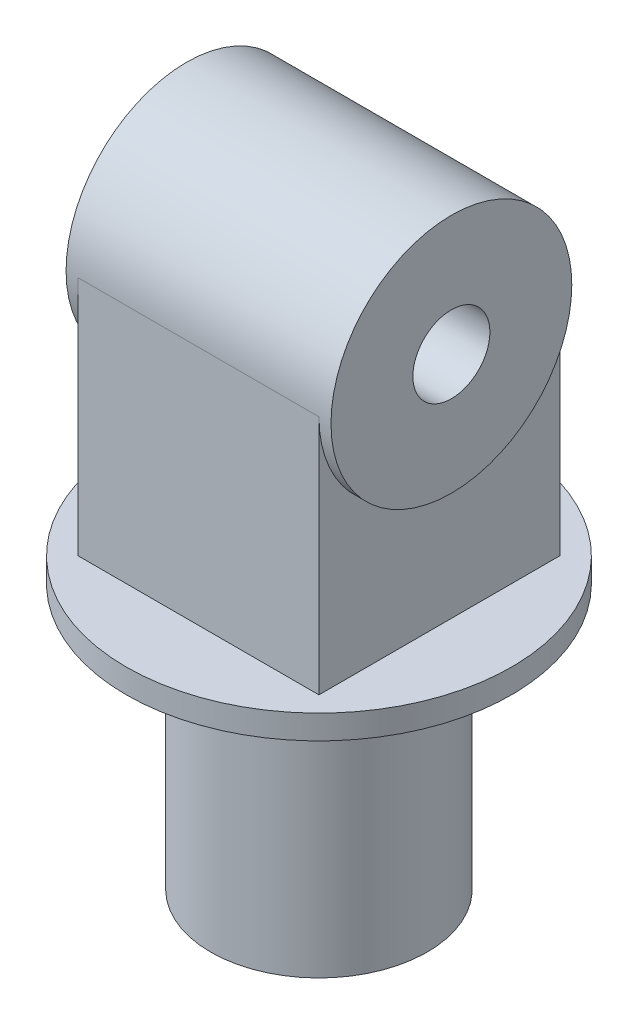
from build123d import *

# Parameters (mm, degrees)
SKETCH1_R           = 22.5
BOSS_EXTRUDE2_DEPTH = 55
SKETCH2_R           = 40
BOSS_EXTRUDE3_DEPTH = 5
SKETCH3_W           = 50
SKETCH3_H           = 50
BOSS_EXTRUDE4_DEPTH = 50
SKETCH4_R           = 25
SKETCH4_R_2         = 8
BOSS_EXTRUDE5_DEPTH = 27.5
CUT_EXTRUDE1_START  = -52.5
CUT_EXTRUDE1_DEPTH  = 50


# Read off the part's stored shape, not the designer's step: Cut-Extrude1
with BuildPart() as part:
    # Sketch1 → Boss-Extrude2 (new body)
    with BuildSketch(Plane(origin=(0, 0, 0), x_dir=(1, 0, 0), z_dir=(0, 1, 0))):
        with Locations(Location((0, 0, 0), (0, 0, 270))):
            Circle(SKETCH1_R)
    extrude(amount=BOSS_EXTRUDE2_DEPTH)

    # Sketch2 → Boss-Extrude3 (add)
    with BuildSketch(Plane(origin=(0, 55, 0), x_dir=(1, 0, 0), z_dir=(0, 1, 0))):
        with Locations(Location((0, 0, 0), (0, 0, 270))):
            Circle(SKETCH2_R)
    extrude(amount=BOSS_EXTRUDE3_DEPTH)

    # Sketch3 → Boss-Extrude4 (add)
    with BuildSketch(Plane(origin=(0, 60, 0), x_dir=(1, 0, 0), z_dir=(0, 1, 0))):
        Rectangle(SKETCH3_W, SKETCH3_H)
    extrude(amount=BOSS_EXTRUDE4_DEPTH)

    # Sketch4 → Boss-Extrude5 (add, symmetric)
    with BuildSketch(Plane(origin=(0, 0, 0), x_dir=(0, 0, -1), z_dir=(1, 0, 0))):
        with Locations((0, 110)):
            Circle(SKETCH4_R)
        with Locations((0, 110)):
            Circle(SKETCH4_R_2, mode=Mode.SUBTRACT)
    extrude(amount=BOSS_EXTRUDE5_DEPTH, both=True)

    # Cut-Extrude1 outline → Cut-Extrude1 (cut)
    with BuildSketch(Plane(origin=(27.5, 0, 0), x_dir=(0, 0, -1), z_dir=(1, 0, 0)).offset(CUT_EXTRUDE1_START)):
        with BuildLine():
            ThreePointArc((-8, 110), (0, 102), (8, 110))
            Line((8, 110), (-8, 110))
        make_face()
    extrude(amount=CUT_EXTRUDE1_DEPTH, mode=Mode.SUBTRACT)


solid = part.part
